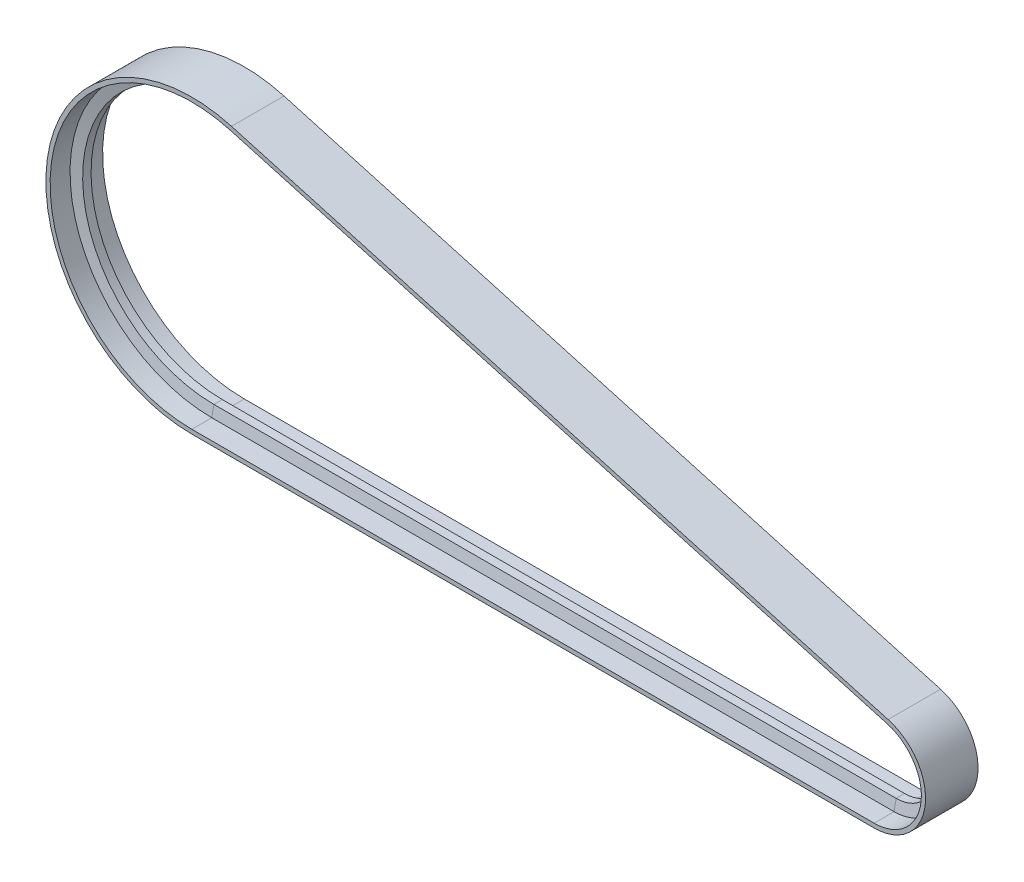
from build123d import *

# Parameters (mm, degrees)
EXTRUDE_THIN1_DEPTH = 12.5


with BuildPart() as part:
    # Sketch1 → Extrude-Thin1 (new, symmetric)
    with BuildSketch(Plane.XY):
        with BuildLine():
            Line((331.557438391, -21.422302573), (18.889795673, 66.883672293))
            ThreePointArc((18.889795673, 66.883672293), (-68.842810897, 9.535060976), (0, -69.5))
            Line((0, -69.5), (324.898445672, -69.5))
            ThreePointArc((324.898445672, -69.5), (349.166774693, -48.361280488), (331.557438391, -21.422302573))
        make_face()
        with BuildLine():
            Line((331.013847149, -23.347012567), (18.346204431, 64.958962299))
            ThreePointArc((18.346204431, 64.958962299), (-66.861722814, 9.260670732), (0, -67.5))
            Line((0, -67.5), (324.898445672, -67.5))
            ThreePointArc((324.898445672, -67.5), (347.18568661, -48.086890244), (331.013847149, -23.347012567))
        make_face(mode=Mode.SUBTRACT)
    extrude(amount=EXTRUDE_THIN1_DEPTH, both=True)

    # Sweep1: sweep along a path in Sketch1<3>
    with BuildLine(Plane.XY) as sweep1_path:
        Line((0, -67.5), (324.898445672, -67.5))
        ThreePointArc((324.898445672, -67.5), (347.18568661, -48.086890244), (331.013847149, -23.347012567))
        Line((331.013847149, -23.347012567), (18.346204431, 64.958962299))
        ThreePointArc((18.346204431, 64.958962299), (-66.861722814, 9.260670732), (0, -67.5))
    # Sketch2 → Sweep1 (sweep)
    with BuildSketch(Plane(origin=(0, 0, 0), x_dir=(0, 0, -1), z_dir=(1, 0, 0))):
        Polygon((-3, -67.5), (-2, -62.5), (2, -62.5), (3, -67.5), align=None)
    sweep(path=sweep1_path.line)


solid = part.part
